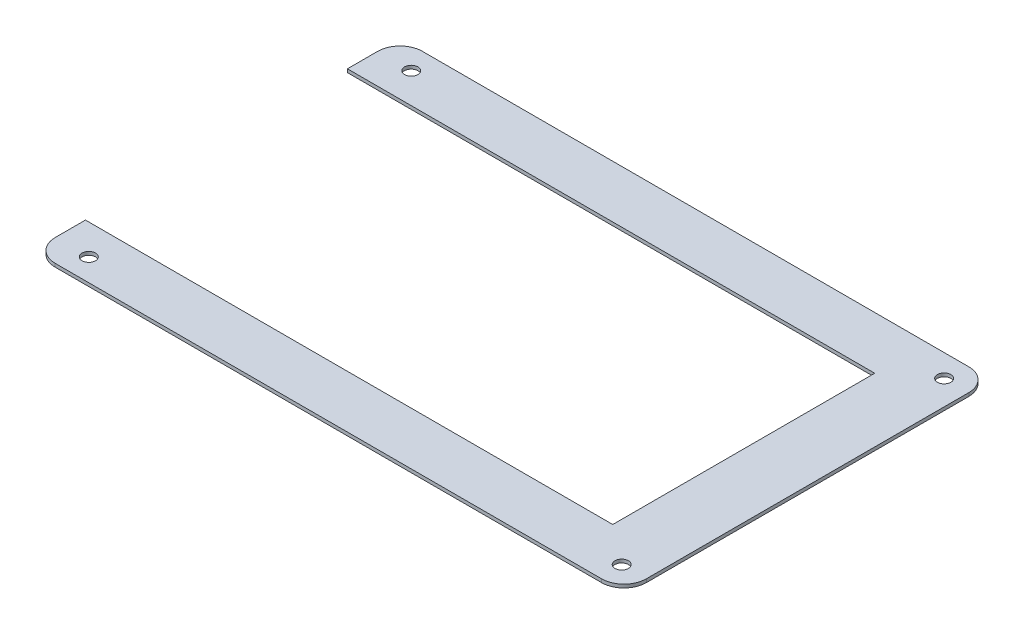
from build123d import *

# Parameters (mm, degrees)
SKETCH1_R          = 3
BASE_FLANGE1_DEPTH = 1.5


# Sheet-metal steps are written as plain solids
with BuildPart() as part:
    # Sketch1 → Base-Flange1 (new body)
    with BuildSketch(Plane(origin=(0, 0, 0), x_dir=(1, 0, 0), z_dir=(0, 1, 0))):
        with BuildLine():
            Line((-127.207269821, 58.5), (-127.207269821, 72))
            ThreePointArc((-127.207269821, 72), (-124.278337633, 79.071067812), (-117.207269821, 82))
            Line((-117.207269821, 82), (126.792730179, 82))
            ThreePointArc((126.792730179, 82), (133.863797991, 79.071067812), (136.792730179, 72))
            Line((136.792730179, 72), (136.792730179, -72))
            ThreePointArc((136.792730179, -72), (133.863797991, -79.071067812), (126.792730179, -82))
            Line((126.792730179, -82), (-117.207269821, -82))
            ThreePointArc((-117.207269821, -82), (-124.278337633, -79.071067812), (-127.207269821, -72))
            Line((-127.207269821, -72), (-127.207269821, -58.5))
            Line((-127.207269821, -58.5), (108.292730179, -58.5))
            Line((108.292730179, -58.5), (108.292730179, 58.5))
            Line((108.292730179, 58.5), (-127.207269821, 58.5))
        make_face()
        with Locations(Location((125.792730179, 72, 0), (0, 0, 270))):
            Circle(SKETCH1_R, mode=Mode.SUBTRACT)
        with Locations(Location((-112.207269821, 72, 0), (0, 0, 270))):
            Circle(SKETCH1_R, mode=Mode.SUBTRACT)
        with Locations(Location((-112.207269821, -72, 0), (0, 0, 270))):
            Circle(SKETCH1_R, mode=Mode.SUBTRACT)
        with Locations(Location((125.792730179, -72, 0), (0, 0, 270))):
            Circle(SKETCH1_R, mode=Mode.SUBTRACT)
    extrude(amount=BASE_FLANGE1_DEPTH)


solid = part.part
